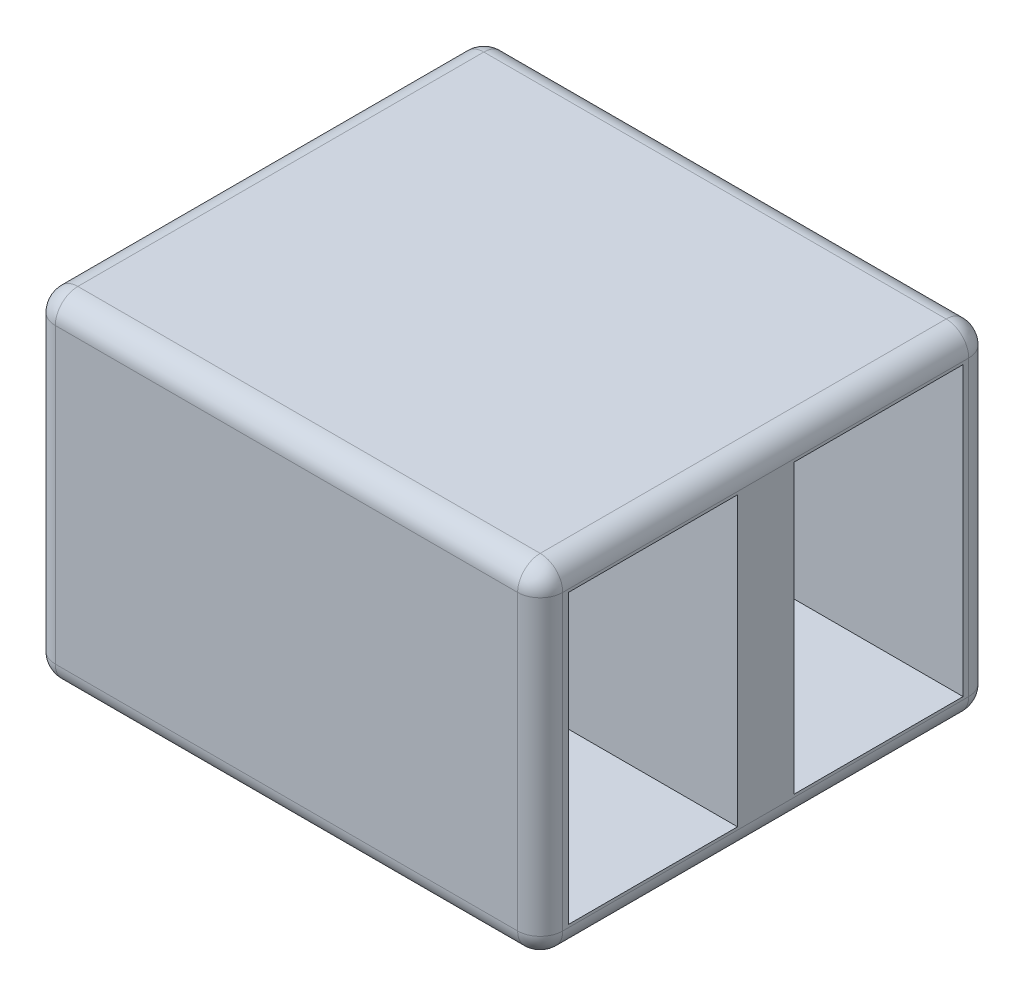
from build123d import *

# Parameters (mm, degrees)
BOSS_EXTRUDE1_DEPTH      = 15
BOSS_EXTRUDE1_DEPTH_BACK = 15
SKETCH1_W                = 45
SKETCH1_H                = 40
CUT_EXTRUDE1_DEPTH       = 12.75
CUT_EXTRUDE1_DEPTH_BACK  = 12.75
SKETCH2_W                = 38
SKETCH2_H                = 15
FILLET1_R                = 13
FILLET2_R                = 2


with BuildPart() as part:
    # Sketch1 → Boss-Extrude1 (new, two sides: drawn at the far end of the back side and taken through both)
    with BuildSketch(Plane(origin=(0, 0, 0), x_dir=(1, 0, 0), z_dir=(0, 1, 0)).offset(-BOSS_EXTRUDE1_DEPTH_BACK)):
        Rectangle(SKETCH1_W, SKETCH1_H)
    extrude(amount=BOSS_EXTRUDE1_DEPTH + BOSS_EXTRUDE1_DEPTH_BACK)

    # Sketch2 → Cut-Extrude1 (cut, two sides: drawn at the far end of the back side and taken through both)
    with BuildSketch(Plane(origin=(0, 0, 0), x_dir=(1, 0, 0), z_dir=(0, 1, 0)).offset(-CUT_EXTRUDE1_DEPTH_BACK)):
        with Locations((3.5, 10)):
            Rectangle(SKETCH2_W, SKETCH2_H)
        with Locations((3.5, -10)):
            Rectangle(SKETCH2_W, SKETCH2_H)
    extrude(amount=CUT_EXTRUDE1_DEPTH + CUT_EXTRUDE1_DEPTH_BACK, mode=Mode.SUBTRACT)

    # Fillet1
    # the kernel refuses this fillet: 13 mm, written as the material it adds along each edge
    with BuildSketch(Plane(origin=(-15.5, -12.75, -17.5), x_dir=(1, 0, 0), z_dir=(0, 0, 1))) as fillet1_piece_1_section:
        with BuildLine():
            CenterArc((FILLET1_R, FILLET1_R), FILLET1_R, 180, 90)
            Line((0, FILLET1_R), (0, 0))
            Line((0, 0), (FILLET1_R, 0))
        make_face()
    fillet1_piece_1 = extrude(amount=47.5, mode=Mode.PRIVATE)
    fillet1_piece_1 = split(fillet1_piece_1, bisect_by=Plane(origin=(-12.596216794, -9.846216794, 17.5), z_dir=(0, 0, -1)), keep=Keep.TOP, mode=Mode.PRIVATE)
    add(fillet1_piece_1)
    with BuildSketch(Plane(origin=(-15.5, 12.75, -17.5), x_dir=(1, 0, 0), z_dir=(0, 0, 1))) as fillet1_piece_2_section:
        with BuildLine():
            CenterArc((FILLET1_R, -FILLET1_R), FILLET1_R, 90, 90)
            Line((0, -FILLET1_R), (0, 0))
            Line((0, 0), (FILLET1_R, 0))
        make_face()
    fillet1_piece_2 = extrude(amount=47.5, mode=Mode.PRIVATE)
    fillet1_piece_2 = split(fillet1_piece_2, bisect_by=Plane(origin=(-12.596216794, 9.846216794, 17.5), z_dir=(0, 0, -1)), keep=Keep.TOP, mode=Mode.PRIVATE)
    add(fillet1_piece_2)
    with BuildSketch(Plane(origin=(-15.5, 12.75, 17.5), x_dir=(1, 0, 0), z_dir=(0, 0, -1))) as fillet1_piece_3_section:
        with BuildLine():
            CenterArc((FILLET1_R, FILLET1_R), FILLET1_R, 180, 90)
            Line((0, FILLET1_R), (0, 0))
            Line((0, 0), (FILLET1_R, 0))
        make_face()
    fillet1_piece_3 = extrude(amount=47.5, mode=Mode.PRIVATE)
    fillet1_piece_3 = split(fillet1_piece_3, bisect_by=Plane(origin=(-12.596216794, 9.846216794, -17.5), z_dir=(0, 0, 1)), keep=Keep.TOP, mode=Mode.PRIVATE)
    add(fillet1_piece_3)
    with BuildSketch(Plane(origin=(-15.5, -12.75, 17.5), x_dir=(1, 0, 0), z_dir=(0, 0, -1))) as fillet1_piece_4_section:
        with BuildLine():
            CenterArc((FILLET1_R, -FILLET1_R), FILLET1_R, 90, 90)
            Line((0, -FILLET1_R), (0, 0))
            Line((0, 0), (FILLET1_R, 0))
        make_face()
    fillet1_piece_4 = extrude(amount=47.5, mode=Mode.PRIVATE)
    fillet1_piece_4 = split(fillet1_piece_4, bisect_by=Plane(origin=(-12.596216794, -9.846216794, -17.5), z_dir=(0, 0, 1)), keep=Keep.TOP, mode=Mode.PRIVATE)
    add(fillet1_piece_4)

    # Fillet2
    fillet2_edges = [part.edges().sort_by_distance(p)[0] for p in [
        (0, 15, -20),
        (-22.5, 15, 0),
        (0, 15, 20),
        (0, -15, -20),
        (22.5, 15, 0),
        (-22.5, -15, 0),
        (0, -15, 20),
        (-22.5, 0, 20),
        (-22.5, 0, -20),
        (22.5, 0, -20),
        (22.5, 0, 20),
        (22.5, -15, 0),
    ]]
    fillet(fillet2_edges, radius=FILLET2_R)

    # Sketch3 → Revolve1 (revolve)
    with BuildSketch(Plane(origin=(0, 0, 0), x_dir=(1, 0, 0), z_dir=(0, 1, 0))):
        Polygon((-22.5, 0), (-32.5, 0), (-22.5, 5), align=None)
    revolve(axis=Axis((-22.5, 0, 0), (-1, 0, 0)))


solid = part.part
